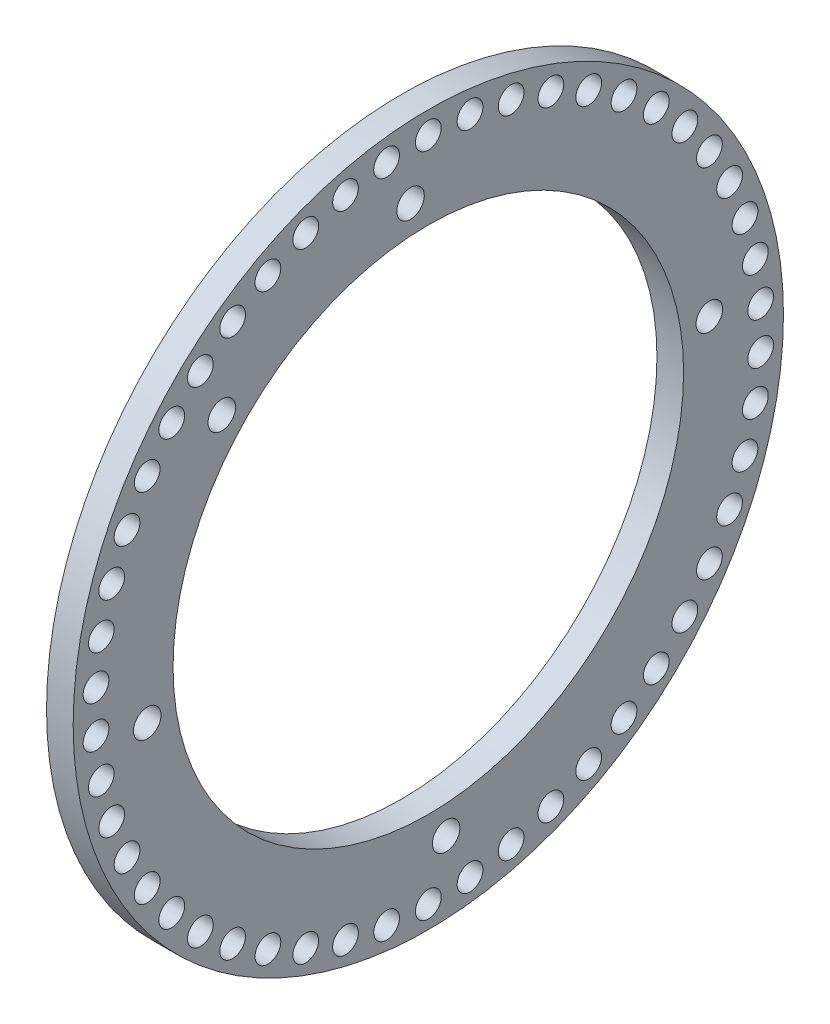
from build123d import *

# Parameters (mm, degrees)
SKETCH1_R           = 40
SKETCH1_R_2         = 1.45
SKETCH1_R_3         = 28.75
SKETCH1_R_4         = 1.55
SKETCH1_R_5         = 1.5
BOSS_EXTRUDE4_DEPTH = 3


with BuildPart() as part:
    # Sketch1 → Boss-Extrude4 (new body)
    with BuildSketch(Plane(origin=(0, 0, 0), x_dir=(0, 0, -1), z_dir=(1, 0, 0))):
        Circle(SKETCH1_R)
        with Locations((0, 37.5)):
            Circle(SKETCH1_R_2, mode=Mode.SUBTRACT)
        Circle(SKETCH1_R_3, mode=Mode.SUBTRACT)
        with Locations((4.699996259, 37.204301299)):
            Circle(SKETCH1_R_2, mode=Mode.SUBTRACT)
        with Locations((9.325870769, 36.321868542)):
            Circle(SKETCH1_R_2, mode=Mode.SUBTRACT)
        with Locations((13.804670726, 34.866618221)):
            Circle(SKETCH1_R_2, mode=Mode.SUBTRACT)
        with Locations((18.065762779, 32.861500502)):
            Circle(SKETCH1_R_2, mode=Mode.SUBTRACT)
        with Locations((22.041946961, 30.338137289)):
            Circle(SKETCH1_R_2, mode=Mode.SUBTRACT)
        with Locations((25.670516472, 27.336323528)):
            Circle(SKETCH1_R_2, mode=Mode.SUBTRACT)
        with Locations((28.894246604, 23.903399616)):
            Circle(SKETCH1_R_2, mode=Mode.SUBTRACT)
        with Locations((31.662297206, 20.093504812)):
            Circle(SKETCH1_R_2, mode=Mode.SUBTRACT)
        with Locations((33.931014467, 15.966723434)):
            Circle(SKETCH1_R_2, mode=Mode.SUBTRACT)
        with Locations((35.664619361, 11.588137289)):
            Circle(SKETCH1_R_2, mode=Mode.SUBTRACT)
        with Locations((36.835771902, 7.026799297)):
            Circle(SKETCH1_R_2, mode=Mode.SUBTRACT)
        with Locations((37.426002316, 2.354644482)):
            Circle(SKETCH1_R_2, mode=Mode.SUBTRACT)
        with Locations((37.426002316, -2.354644482)):
            Circle(SKETCH1_R_2, mode=Mode.SUBTRACT)
        with Locations((36.835771902, -7.026799297)):
            Circle(SKETCH1_R_2, mode=Mode.SUBTRACT)
        with Locations((35.664619361, -11.588137289)):
            Circle(SKETCH1_R_2, mode=Mode.SUBTRACT)
        with Locations((33.931014467, -15.966723434)):
            Circle(SKETCH1_R_2, mode=Mode.SUBTRACT)
        with Locations((31.662297206, -20.093504812)):
            Circle(SKETCH1_R_2, mode=Mode.SUBTRACT)
        with Locations((28.894246604, -23.903399616)):
            Circle(SKETCH1_R_2, mode=Mode.SUBTRACT)
        with Locations((25.670516472, -27.336323528)):
            Circle(SKETCH1_R_2, mode=Mode.SUBTRACT)
        with Locations((22.041946961, -30.338137289)):
            Circle(SKETCH1_R_2, mode=Mode.SUBTRACT)
        with Locations((18.065762779, -32.861500502)):
            Circle(SKETCH1_R_2, mode=Mode.SUBTRACT)
        with Locations((13.804670726, -34.866618221)):
            Circle(SKETCH1_R_2, mode=Mode.SUBTRACT)
        with Locations((9.325870769, -36.321868542)):
            Circle(SKETCH1_R_2, mode=Mode.SUBTRACT)
        with Locations((4.699996259, -37.204301299)):
            Circle(SKETCH1_R_2, mode=Mode.SUBTRACT)
        with Locations((0, -37.5)):
            Circle(SKETCH1_R_2, mode=Mode.SUBTRACT)
        with Locations((-4.699996259, -37.204301299)):
            Circle(SKETCH1_R_2, mode=Mode.SUBTRACT)
        with Locations((-9.325870769, -36.321868542)):
            Circle(SKETCH1_R_2, mode=Mode.SUBTRACT)
        with Locations((-13.804670726, -34.866618221)):
            Circle(SKETCH1_R_2, mode=Mode.SUBTRACT)
        with Locations((-18.065762779, -32.861500502)):
            Circle(SKETCH1_R_2, mode=Mode.SUBTRACT)
        with Locations((-22.041946961, -30.338137289)):
            Circle(SKETCH1_R_2, mode=Mode.SUBTRACT)
        with Locations((-25.670516472, -27.336323528)):
            Circle(SKETCH1_R_2, mode=Mode.SUBTRACT)
        with Locations((-28.894246604, -23.903399616)):
            Circle(SKETCH1_R_2, mode=Mode.SUBTRACT)
        with Locations((-31.662297206, -20.093504812)):
            Circle(SKETCH1_R_2, mode=Mode.SUBTRACT)
        with Locations((-33.931014467, -15.966723434)):
            Circle(SKETCH1_R_2, mode=Mode.SUBTRACT)
        with Locations((-35.664619361, -11.588137289)):
            Circle(SKETCH1_R_2, mode=Mode.SUBTRACT)
        with Locations((-36.835771902, -7.026799297)):
            Circle(SKETCH1_R_2, mode=Mode.SUBTRACT)
        with Locations((-37.426002316, -2.354644482)):
            Circle(SKETCH1_R_2, mode=Mode.SUBTRACT)
        with Locations((-37.426002316, 2.354644482)):
            Circle(SKETCH1_R_2, mode=Mode.SUBTRACT)
        with Locations((-36.835771902, 7.026799297)):
            Circle(SKETCH1_R_2, mode=Mode.SUBTRACT)
        with Locations((-35.664619361, 11.588137289)):
            Circle(SKETCH1_R_2, mode=Mode.SUBTRACT)
        with Locations((-33.931014467, 15.966723434)):
            Circle(SKETCH1_R_2, mode=Mode.SUBTRACT)
        with Locations((-31.662297206, 20.093504812)):
            Circle(SKETCH1_R_2, mode=Mode.SUBTRACT)
        with Locations((-28.894246604, 23.903399616)):
            Circle(SKETCH1_R_2, mode=Mode.SUBTRACT)
        with Locations((-25.670516472, 27.336323528)):
            Circle(SKETCH1_R_2, mode=Mode.SUBTRACT)
        with Locations((-22.041946961, 30.338137289)):
            Circle(SKETCH1_R_2, mode=Mode.SUBTRACT)
        with Locations((-18.065762779, 32.861500502)):
            Circle(SKETCH1_R_2, mode=Mode.SUBTRACT)
        with Locations((-13.804670726, 34.866618221)):
            Circle(SKETCH1_R_2, mode=Mode.SUBTRACT)
        with Locations((-9.325870769, 36.321868542)):
            Circle(SKETCH1_R_2, mode=Mode.SUBTRACT)
        with Locations((-4.699996259, 37.204301299)):
            Circle(SKETCH1_R_2, mode=Mode.SUBTRACT)
        with Locations((-2.003478367, 31.844376742)):
            Circle(SKETCH1_R_4, mode=Mode.SUBTRACT)
        with Locations((-31.655739691, -3.999049919)):
            Circle(SKETCH1_R_4, mode=Mode.SUBTRACT)
        with Locations((2.003478367, -31.844376742)):
            Circle(SKETCH1_R_4, mode=Mode.SUBTRACT)
        with Locations((31.655739691, 3.999049919)):
            Circle(SKETCH1_R_5, mode=Mode.SUBTRACT)
        with Locations((-23.259448814, 21.842076287)):
            Circle(SKETCH1_R_4, mode=Mode.SUBTRACT)
    extrude(amount=BOSS_EXTRUDE4_DEPTH)


solid = part.part
